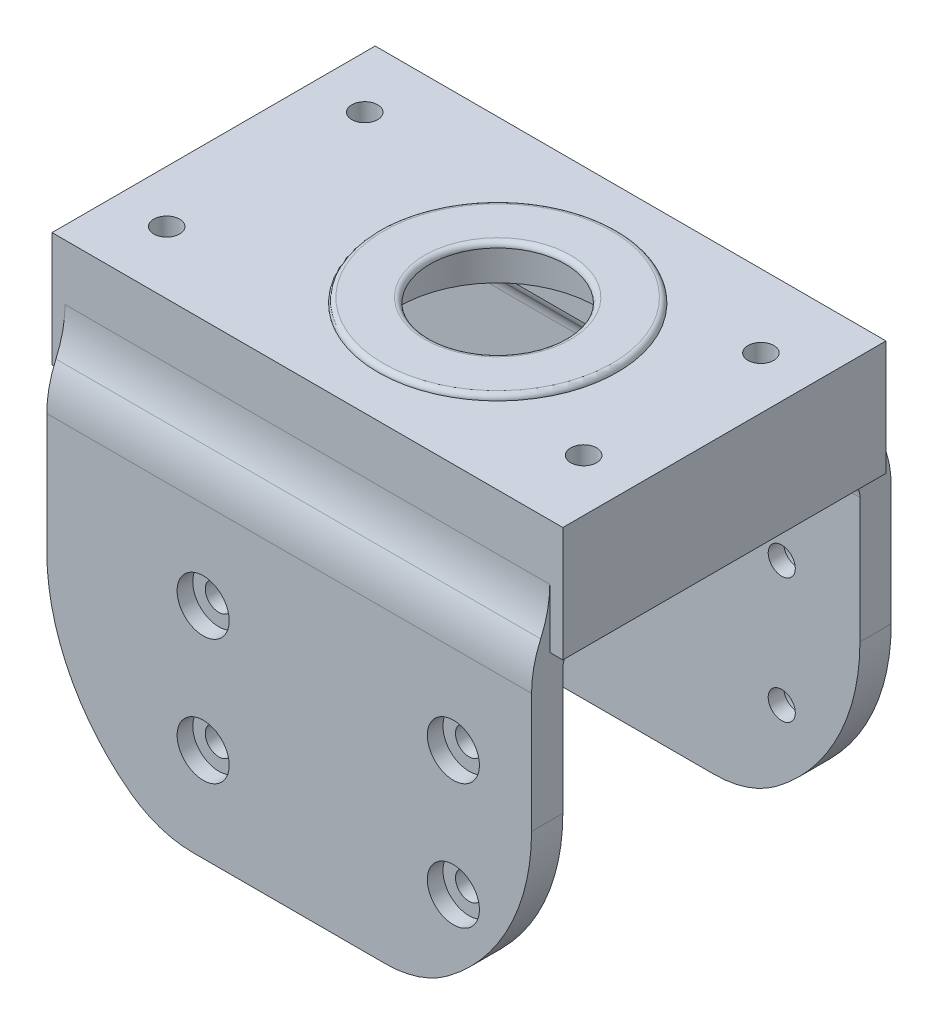
from build123d import *

# Parameters (mm, degrees)
SKETCH1_W           = 45
SKETCH1_H           = 27
SKETCH1_R           = 9.475
SKETCH1_R_2         = 1.24
BOSS_EXTRUDE1_DEPTH = 5
SKETCH1_3_W         = 49
SKETCH1_3_H         = 31
SKETCH1_3_W_2       = 45
SKETCH1_3_H_2       = 27
BOSS_EXTRUDE2_DEPTH = 11
SKETCH2_W           = 46.5
SKETCH2_H           = 1.75
SKETCH2_H_2         = 1.25
BOSS_EXTRUDE3_DEPTH = 34
BOSS_EXTRUDE4_REACH = 49.319
BOSS_EXTRUDE4_START = -2
SKETCH2_4_W         = 30
SKETCH2_4_H         = 2
SKETCH3_R           = 1.3
CUT_EXTRUDE2_DEPTH  = 62.769733689
SKETCH3_3_R         = 2.5
SKETCH3_3_R_2       = 1.3
CUT_EXTRUDE3_DEPTH  = 1.5
FILLET3_R           = 10
FILLET4_R           = 10
FILLET5_R           = 2
FILLET6_R           = 2
FILLET7_R           = 20
SKETCH4_R           = 11.475
SKETCH4_R_2         = 6.5
BOSS_EXTRUDE5_DEPTH = 0.5
FILLET8_R           = 0.5
CUT_EXTRUDE4_DEPTH  = 62.769733689
FILLET9_R           = 10


# Some blends are built 0.0001 mm under size
with BuildPart() as part:
    # Sketch1 → Boss-Extrude1 (new body)
    with BuildSketch(Plane(origin=(0, 0, 0), x_dir=(1, 0, 0), z_dir=(0, 1, 0))):
        Rectangle(SKETCH1_W, SKETCH1_H)
        with Locations(Location((2.75, 0, 0), (0, 0, 270))):
            Circle(SKETCH1_R, mode=Mode.SUBTRACT)
        with Locations(Location((-19.5, 9.5, 0), (0, 0, 270))):
            Circle(SKETCH1_R_2, mode=Mode.SUBTRACT)
        with Locations(Location((-19.5, -9.5, 0), (0, 0, 270))):
            Circle(SKETCH1_R_2, mode=Mode.SUBTRACT)
        with Locations(Location((19.5, -8.5, 0), (0, 0, 270))):
            Circle(SKETCH1_R_2, mode=Mode.SUBTRACT)
        with Locations(Location((19.5, 8.5, 0), (0, 0, 270))):
            Circle(SKETCH1_R_2, mode=Mode.SUBTRACT)
    extrude(amount=-BOSS_EXTRUDE1_DEPTH)

    # Sketch1<3> → Boss-Extrude2 (add)
    with BuildSketch(Plane(origin=(0, 0, 0), x_dir=(1, 0, 0), z_dir=(0, 1, 0))):
        Rectangle(SKETCH1_3_W, SKETCH1_3_H)
        Rectangle(SKETCH1_3_W_2, SKETCH1_3_H_2, mode=Mode.SUBTRACT)
    extrude(amount=-BOSS_EXTRUDE2_DEPTH)

    # Sketch2 → Boss-Extrude3 (add)
    with BuildSketch(Plane.XZ.offset(11)):
        with Locations((0, 16.375)):
            Rectangle(SKETCH2_W, SKETCH2_H)
        with Locations((0, 14.875)):
            Rectangle(SKETCH2_W, SKETCH2_H_2)
        with Locations((0, -14.875)):
            Rectangle(SKETCH2_W, SKETCH2_H_2)
        with Locations((0, -16.375)):
            Rectangle(SKETCH2_W, SKETCH2_H)
    extrude(amount=BOSS_EXTRUDE3_DEPTH)

    # Sketch2<4> → Boss-Extrude4 (add, up to next)
    with BuildSketch(Plane.XZ.offset(11).offset(BOSS_EXTRUDE4_START), mode=Mode.PRIVATE) as boss_extrude4_sk1:
        with Locations((0, 12.5)):
            Rectangle(SKETCH2_4_W, SKETCH2_4_H)
    boss_extrude4_tool1 = extrude(boss_extrude4_sk1.sketch, amount=-BOSS_EXTRUDE4_REACH, mode=Mode.PRIVATE) - part.part
    # Sketch2<4> → Boss-Extrude4 (add, up to next)
    with BuildSketch(Plane.XZ.offset(11).offset(BOSS_EXTRUDE4_START), mode=Mode.PRIVATE) as boss_extrude4_sk2:
        with Locations((0, -12.5)):
            Rectangle(SKETCH2_4_W, SKETCH2_4_H)
    boss_extrude4_tool2 = extrude(boss_extrude4_sk2.sketch, amount=-BOSS_EXTRUDE4_REACH, mode=Mode.PRIVATE) - part.part
    add(boss_extrude4_tool1.solids().sort_by_distance((0, -9, 12.5))[0])
    add(boss_extrude4_tool2.solids().sort_by_distance((0, -9, -12.5))[0])

    # Sketch3 → Cut-Extrude2 (cut, through all)
    with BuildSketch(Plane(origin=(0, 0, -17.25), x_dir=(-1, 0, 0), z_dir=(0, 0, -1))):
        with Locations((-15.75, -22)):
            Circle(SKETCH3_R)
        with Locations((8.25, -22)):
            Circle(SKETCH3_R)
        with Locations((8.25, -34)):
            Circle(SKETCH3_R)
        with Locations((-15.75, -34)):
            Circle(SKETCH3_R)
    extrude(amount=-CUT_EXTRUDE2_DEPTH, mode=Mode.SUBTRACT)

    # Sketch3<3> → Cut-Extrude3 (cut)
    # profile 1 of 4: a face of its own
    with BuildSketch(Plane(origin=(0, 0, -17.25), x_dir=(-1, 0, 0), z_dir=(0, 0, -1))):
        with Locations((-15.75, -22)):
            Circle(SKETCH3_3_R)
        with Locations((-15.75, -22)):
            Circle(SKETCH3_3_R_2, mode=Mode.SUBTRACT)
    # profile 2 of 4: a face of its own
    with BuildSketch(Plane(origin=(0, 0, -17.25), x_dir=(-1, 0, 0), z_dir=(0, 0, -1))):
        with Locations((-15.75, -34)):
            Circle(SKETCH3_3_R)
        with Locations((-15.75, -34)):
            Circle(SKETCH3_3_R_2, mode=Mode.SUBTRACT)
    # profile 3 of 4: a face of its own
    with BuildSketch(Plane(origin=(0, 0, -17.25), x_dir=(-1, 0, 0), z_dir=(0, 0, -1))):
        with Locations((8.25, -34)):
            Circle(SKETCH3_3_R)
        with Locations((8.25, -34)):
            Circle(SKETCH3_3_R_2, mode=Mode.SUBTRACT)
    # profile 4 of 4: a face of its own
    with BuildSketch(Plane(origin=(0, 0, -17.25), x_dir=(-1, 0, 0), z_dir=(0, 0, -1))):
        with Locations((8.25, -22)):
            Circle(SKETCH3_3_R)
        with Locations((8.25, -22)):
            Circle(SKETCH3_3_R_2, mode=Mode.SUBTRACT)
    cut_extrude3 = extrude(amount=-CUT_EXTRUDE3_DEPTH, mode=Mode.SUBTRACT)

    # Mirror1: Cut-Extrude3 across plane
    add(cut_extrude3.mirror(Plane.XY), mode=Mode.SUBTRACT)

    # Fillet3
    # the kernel refuses this fillet: 10 mm, written as the material it adds along each edge
    with BuildSketch(Plane(origin=(-23.25, -11, -15.5), x_dir=(0, 1, 0), z_dir=(1, 0, 0)), Plane(origin=(23.25, -11, 15.5), x_dir=(0, 1, 0), z_dir=(-1, 0, 0))) as fillet3_piece_1:
        with BuildLine():
            CenterArc((5.651327278, -10), FILLET3_R, 90, 34.41150867)
            Line((0, -1.75), (0, 0))
            Line((0, 0), (5.651327278, 0))
        make_face()
    extrude(amount=46.5)

    # Fillet4
    fillet4_edges = [part.edges().sort_by_distance(p)[0] for p in [
        (0, -11, 17.25),
        (0, -11, -17.25),
    ]]
    fillet(fillet4_edges, radius=FILLET4_R)

    # Fillet5
    # the kernel refuses this fillet: 2 mm, written as the material it adds along each edge
    with BuildSketch(Plane(origin=(-23.25, -11, 14.25), x_dir=(0, 0, -1), z_dir=(1, 0, 0))) as fillet5_piece_1_section:
        with BuildLine():
            CenterArc((FILLET5_R, -FILLET5_R), FILLET5_R, 90, 90)
            Line((0, -FILLET5_R), (0, 0))
            Line((0, 0), (FILLET5_R, 0))
        make_face()
    fillet5_piece_1 = extrude(amount=51.5, mode=Mode.PRIVATE)
    fillet5_piece_1 = split(fillet5_piece_1, bisect_by=Plane(origin=(-22.5, -11.128717382, 13.194770831), z_dir=(-1, 0, 0)), keep=Keep.TOP, mode=Mode.PRIVATE)
    add(fillet5_piece_1)
    with BuildSketch(Plane(origin=(-28.25, -11, 14.25), x_dir=(0, 0, -1), z_dir=(1, 0, 0))) as fillet5_piece_2_section:
        with BuildLine():
            CenterArc((FILLET5_R, -FILLET5_R), FILLET5_R, 90, 90)
            Line((0, -FILLET5_R), (0, 0))
            Line((0, 0), (FILLET5_R, 0))
        make_face()
    fillet5_piece_2 = extrude(amount=51.5, mode=Mode.PRIVATE)
    fillet5_piece_2 = split(fillet5_piece_2, bisect_by=Plane(origin=(0, -11.527561527, 13.5), z_dir=(0, 0, 1)), keep=Keep.TOP, mode=Mode.PRIVATE)
    fillet5_piece_2 = split(fillet5_piece_2, bisect_by=Plane(origin=(-22.5, -11.527561527, 13.95791508), z_dir=(1, 0, 0)), keep=Keep.TOP, mode=Mode.PRIVATE)
    add(fillet5_piece_2)
    with BuildSketch(Plane(origin=(-28.25, -11, 14.25), x_dir=(0, 0, -1), z_dir=(1, 0, 0))) as fillet5_piece_3_section:
        with BuildLine():
            CenterArc((FILLET5_R, -FILLET5_R), FILLET5_R, 90, 90)
            Line((0, -FILLET5_R), (0, 0))
            Line((0, 0), (FILLET5_R, 0))
        make_face()
    fillet5_piece_3 = extrude(amount=51.5, mode=Mode.PRIVATE)
    fillet5_piece_3 = split(fillet5_piece_3, bisect_by=Plane(origin=(22.5, -11.128717382, 13.194770831), z_dir=(1, 0, 0)), keep=Keep.TOP, mode=Mode.PRIVATE)
    add(fillet5_piece_3)
    with BuildSketch(Plane(origin=(23.25, -11, -14.25), x_dir=(0, 0, 1), z_dir=(-1, 0, 0))) as fillet5_piece_4_section:
        with BuildLine():
            CenterArc((FILLET5_R, -FILLET5_R), FILLET5_R, 90, 90)
            Line((0, -FILLET5_R), (0, 0))
            Line((0, 0), (FILLET5_R, 0))
        make_face()
    fillet5_piece_4 = extrude(amount=51.5, mode=Mode.PRIVATE)
    fillet5_piece_4 = split(fillet5_piece_4, bisect_by=Plane(origin=(22.5, -11.128717382, -13.194770831), z_dir=(1, 0, 0)), keep=Keep.TOP, mode=Mode.PRIVATE)
    add(fillet5_piece_4)
    with BuildSketch(Plane(origin=(28.25, -11, -14.25), x_dir=(0, 0, 1), z_dir=(-1, 0, 0))) as fillet5_piece_5_section:
        with BuildLine():
            CenterArc((FILLET5_R, -FILLET5_R), FILLET5_R, 90, 90)
            Line((0, -FILLET5_R), (0, 0))
            Line((0, 0), (FILLET5_R, 0))
        make_face()
    fillet5_piece_5 = extrude(amount=51.5, mode=Mode.PRIVATE)
    fillet5_piece_5 = split(fillet5_piece_5, bisect_by=Plane(origin=(22.5, -11.527561527, -13.95791508), z_dir=(-1, 0, 0)), keep=Keep.TOP, mode=Mode.PRIVATE)
    fillet5_piece_5 = split(fillet5_piece_5, bisect_by=Plane(origin=(0, -11.527561527, -13.5), z_dir=(0, 0, -1)), keep=Keep.TOP, mode=Mode.PRIVATE)
    add(fillet5_piece_5)
    with BuildSketch(Plane(origin=(28.25, -11, -14.25), x_dir=(0, 0, 1), z_dir=(-1, 0, 0))) as fillet5_piece_6_section:
        with BuildLine():
            CenterArc((FILLET5_R, -FILLET5_R), FILLET5_R, 90, 90)
            Line((0, -FILLET5_R), (0, 0))
            Line((0, 0), (FILLET5_R, 0))
        make_face()
    fillet5_piece_6 = extrude(amount=51.5, mode=Mode.PRIVATE)
    fillet5_piece_6 = split(fillet5_piece_6, bisect_by=Plane(origin=(-22.5, -11.128717382, -13.194770831), z_dir=(-1, 0, 0)), keep=Keep.TOP, mode=Mode.PRIVATE)
    add(fillet5_piece_6)

    # Fillet6
    fillet6_edges = [part.edges().sort_by_distance(p)[0] for p in [
        (0, -11.4387505, 13.5),
        (0, -11.4387505, -13.5),
    ]]
    fillet(fillet6_edges, radius=FILLET6_R)

    # Fillet7
    fillet7_edges = [part.edges().sort_by_distance(p)[0] for p in [
        (-23.25, -45, 15.75),
        (23.25, -45, 15.75),
        (23.25, -45, -15.75),
        (-23.25, -45, -15.75),
    ]]
    fillet(fillet7_edges, radius=FILLET7_R)

    # Sketch4 → Boss-Extrude5 (add)
    with BuildSketch(Plane(origin=(0, 0, 0), x_dir=(1, 0, 0), z_dir=(0, 1, 0))):
        with Locations(Location((2.75, 0, 0), (0, 0, 270))):
            Circle(SKETCH4_R)
        with Locations(Location((2.75, 0, 0), (0, 0, 270))):
            Circle(SKETCH4_R_2, mode=Mode.SUBTRACT)
    extrude(amount=BOSS_EXTRUDE5_DEPTH)

    # Fillet8
    fillet8_edges = [part.edges().sort_by_distance(p)[0] for p in [
        (2.75, 0.5, -11.475),
        (2.75, 0.5, -6.5),
    ]]
    fillet(fillet8_edges, radius=FILLET8_R - 0.0001)  # a hair under: the kernel refuses the full size

    # Sketch5 → Cut-Extrude4 (cut, through all)
    with BuildSketch(Plane(origin=(0, 0, -17.25), x_dir=(-1, 0, 0), z_dir=(0, 0, -1))):
        with BuildLine():
            Line((-11.967797887, -43), (11.967797887, -43))
            ThreePointArc((11.967797887, -43), (7.722135955, -44.49358869), (3.25, -45))
            Line((3.25, -45), (-3.25, -45))
            ThreePointArc((-3.25, -45), (-7.722135955, -44.49358869), (-11.967797887, -43))
        make_face()
    extrude(amount=-CUT_EXTRUDE4_DEPTH, mode=Mode.SUBTRACT)

    # Fillet9
    fillet9_edges = [part.edges().sort_by_distance(p)[0] for p in [
        (11.967797887, -43, -15.75),
        (-11.967797887, -43, 15.75),
        (11.967797887, -43, 15.75),
        (-11.967797887, -43, -15.75),
    ]]
    fillet(fillet9_edges, radius=FILLET9_R)


solid = part.part
